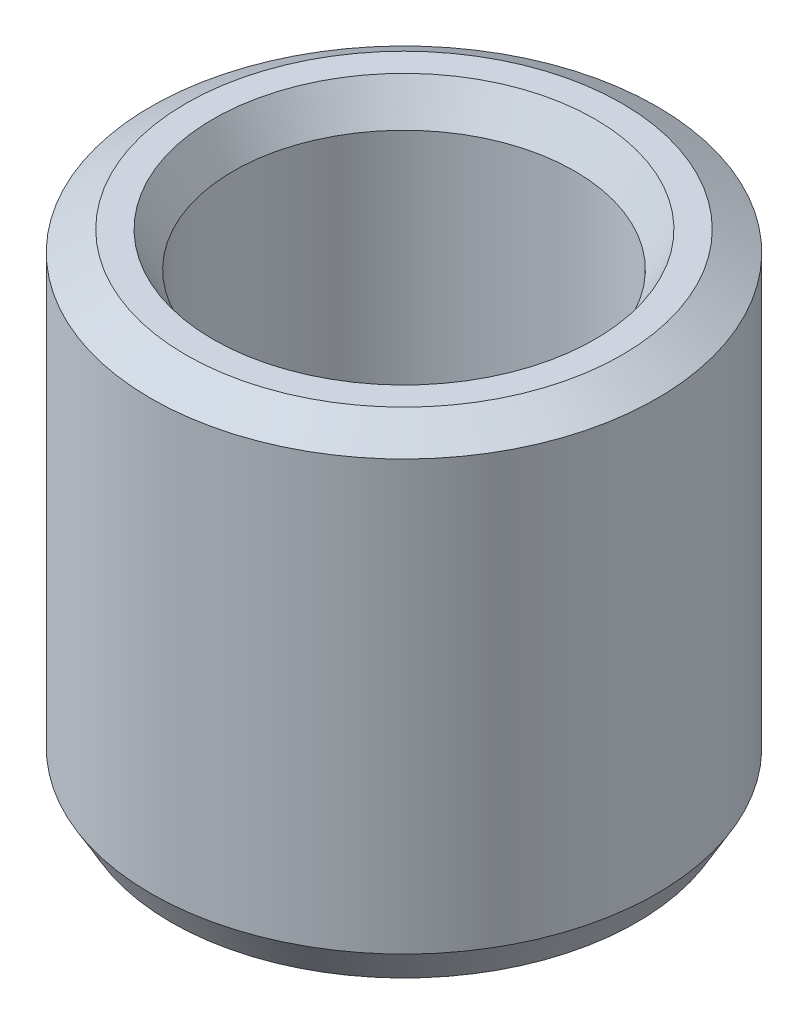
from build123d import *
from OCP.BRepFilletAPI import BRepFilletAPI_MakeChamfer

# Parameters (mm, degrees)
SKETCH1_R           = 32.5
BOSS_EXTRUDE1_DEPTH = 62.174237526
SKETCH2_R           = 21.929456321
CUT_EXTRUDE1_DEPTH  = 78.318405389
CHAMFER1_SIZE       = 2.595201394
CHAMFER1_SIZE2      = 4.49502067


with BuildPart() as part:
    # Sketch1 → Boss-Extrude1 (new body)
    with BuildSketch(Plane(origin=(0, 0, 0), x_dir=(1, 0, 0), z_dir=(0, 1, 0))):
        Circle(SKETCH1_R)
    extrude(amount=BOSS_EXTRUDE1_DEPTH)

    # Sketch2 → Cut-Extrude1 (cut, through all)
    with BuildSketch(Plane(origin=(0, 0, 0), x_dir=(1, 0, 0), z_dir=(0, 1, 0))):
        Circle(SKETCH2_R)
    extrude(amount=CUT_EXTRUDE1_DEPTH, mode=Mode.SUBTRACT)

    # Chamfer1: one chamfer whose edges measure the first distance from different faces: ONE call of the kernel's chamfer builder (chamfer() names one face for all edges)
    chamfer1_edges_1 = [part.edges().sort_by_distance(p)[0] for p in [
        (-21.929456321, 62.174237526, 0),
    ]]
    chamfer1_side_1 = [part.faces().sort_by_distance(p)[0] for p in [
        (-31.580761184, 62.174237526, 0),
    ]]
    chamfer1_edges_2 = [part.edges().sort_by_distance(p)[0] for p in [
        (-21.929456321, 0, 0),
    ]]
    chamfer1_side_2 = [part.faces().sort_by_distance(p)[0] for p in [
        (-21.929456321, 31.087118763, 0),
    ]]
    chamfer1_edges_3 = [part.edges().sort_by_distance(p)[0] for p in [
        (-32.5, 0, 0),
    ]]
    chamfer1_side_3 = [part.faces().sort_by_distance(p)[0] for p in [
        (-31.580761184, 0, 0),
    ]]
    chamfer1_edges_4 = [part.edges().sort_by_distance(p)[0] for p in [
        (-32.5, 62.174237526, 0),
    ]]
    chamfer1_side_4 = [part.faces().sort_by_distance(p)[0] for p in [
        (-32.5, 31.087118763, 0),
    ]]
    chamfer1 = BRepFilletAPI_MakeChamfer(part.part.solid().wrapped)
    for e in chamfer1_edges_1:
        chamfer1.Add(CHAMFER1_SIZE, CHAMFER1_SIZE2, e.wrapped, chamfer1_side_1[0].wrapped)  # the first distance lies on this face
    for e in chamfer1_edges_2:
        chamfer1.Add(CHAMFER1_SIZE, CHAMFER1_SIZE2, e.wrapped, chamfer1_side_2[0].wrapped)  # the first distance lies on this face
    for e in chamfer1_edges_3:
        chamfer1.Add(CHAMFER1_SIZE, CHAMFER1_SIZE2, e.wrapped, chamfer1_side_3[0].wrapped)  # the first distance lies on this face
    for e in chamfer1_edges_4:
        chamfer1.Add(CHAMFER1_SIZE, CHAMFER1_SIZE2, e.wrapped, chamfer1_side_4[0].wrapped)  # the first distance lies on this face
    add(Compound.cast(chamfer1.Shape()), mode=Mode.REPLACE)


solid = part.part
